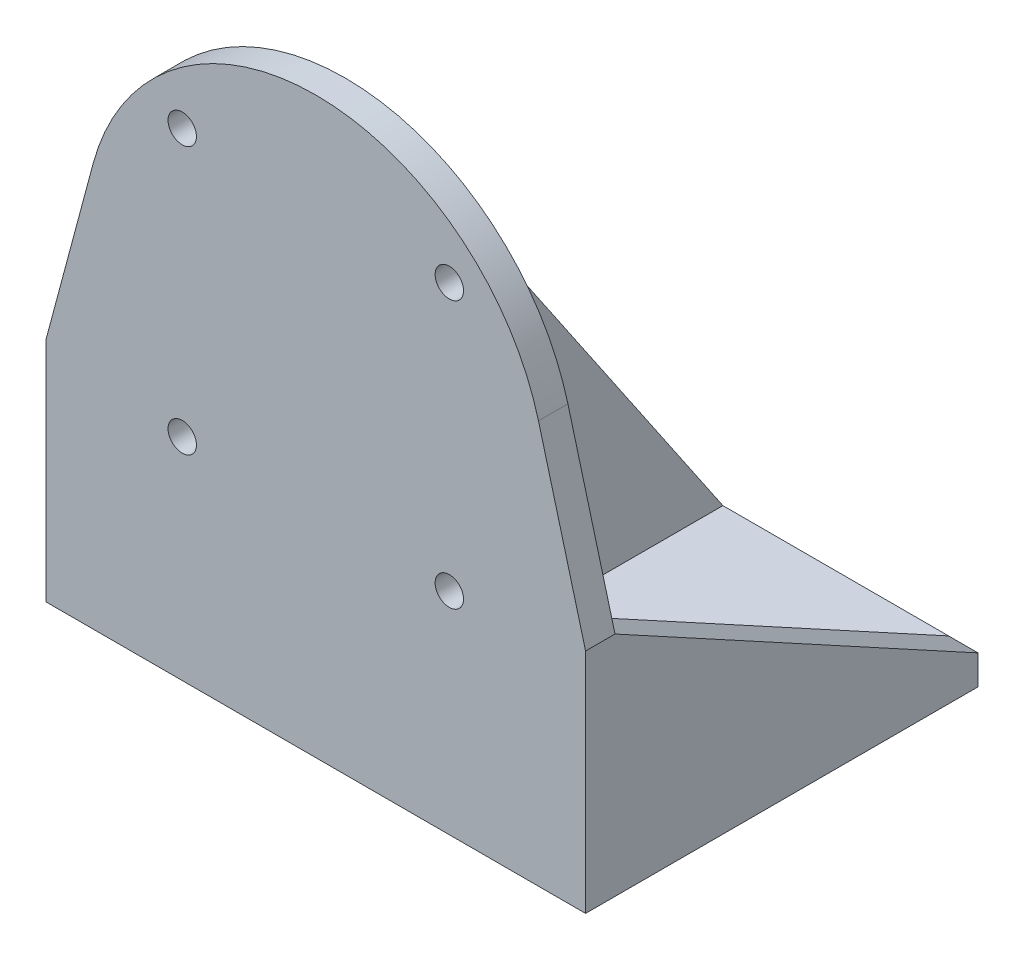
from build123d import *

# Parameters (mm, degrees)
SKETCH_1_R           = 1.447765
EXTRUDE_1_DEPTH      = 3
SKETCH_2_W           = 54.999996422
SKETCH_2_H           = 3
EXTRUDE_2_DEPTH      = 37
CUT_EXTRUDE_1_DEPTH  = 3
EXTRUDE_3_DEPTH      = 3
EXTRUDE_4_DEPTH      = 1.5
EXTRUDE_4_DEPTH_BACK = 1.5


with BuildPart() as part:
    # 草图1 → 凸台-拉伸1 (new body)
    with BuildSketch(Plane.XY):
        with BuildLine():
            Line((-13.887998211, -25.578349272), (-13.887998211, -48.743989272))
            Line((-13.887998211, -48.743989272), (41.111998211, -48.743989272))
            Line((41.111998211, -48.743989272), (41.111998211, -25.578349272))
            Line((41.111998211, -25.578349272), (36.311256918, -7.661738854))
            ThreePointArc((36.311256918, -7.661738854), (13.612, 9.756013586), (-9.087256918, -7.661738854))
            Line((-9.087256918, -7.661738854), (-13.887998211, -25.578349272))
        make_face()
        Circle(SKETCH_1_R, mode=Mode.SUBTRACT)
        with Locations((27.224, 0)):
            Circle(SKETCH_1_R, mode=Mode.SUBTRACT)
        with Locations((0, -27.224)):
            Circle(SKETCH_1_R, mode=Mode.SUBTRACT)
        with Locations((27.224, -27.224)):
            Circle(SKETCH_1_R, mode=Mode.SUBTRACT)
    extrude(amount=-EXTRUDE_1_DEPTH)

    # 草图2 → 凸台-拉伸2 (add)
    with BuildSketch(Plane(origin=(0, 0, -3), x_dir=(-1, 0, 0), z_dir=(0, 0, -1))):
        with Locations((-13.612, -47.243989272)):
            Rectangle(SKETCH_2_W, SKETCH_2_H)
    extrude(amount=EXTRUDE_2_DEPTH)

    # 草图3 → 切除-拉伸1 (cut)
    with BuildSketch(Plane(origin=(0, -45.743989272, 0), x_dir=(1, 0, 0), z_dir=(0, 1, 0))):
        with BuildLine():
            Line((32.311998211, 13), (32.311998211, 30))
            ThreePointArc((32.311998211, 30), (30.711998211, 31.6), (29.111998211, 30))
            Line((29.111998211, 30), (29.111998211, 13))
            ThreePointArc((29.111998211, 13), (30.711998211, 12.571016578), (32.311998211, 13))
        make_face()
        with BuildLine():
            Line((-1.887998211, 30), (-1.887998211, 13))
            ThreePointArc((-1.887998211, 13), (-3.487998211, 12.571016578), (-5.087998211, 13))
            Line((-5.087998211, 13), (-5.087998211, 30))
            ThreePointArc((-5.087998211, 30), (-3.487998211, 31.6), (-1.887998211, 30))
        make_face()
    extrude(amount=-CUT_EXTRUDE_1_DEPTH, mode=Mode.SUBTRACT)

    # 草图4 → 凸台-拉伸3 (add)
    with BuildSketch(Plane(origin=(41.111998211, 0, 0), x_dir=(0, 0, -1), z_dir=(1, 0, 0))):
        Polygon((40, -45.743989272), (3, -25.578345661), (3, -45.743989272), align=None)
    extrude_3 = extrude(amount=-EXTRUDE_3_DEPTH)

    # 草图13 → 凸台-拉伸4 (add, two sides: drawn at the far end of the back side and taken through both)
    with BuildSketch(Plane(origin=(13.612, 0, 0), x_dir=(0, 1, 0), z_dir=(-1, 0, 0)).offset(-EXTRUDE_4_DEPTH_BACK)):
        Polygon((-45.743989272, 40), (8.756018173, 3), (-45.743989272, 3), align=None)
    extrude(amount=EXTRUDE_4_DEPTH + EXTRUDE_4_DEPTH_BACK)

    # 镜向1: 凸台-拉伸3 across plane
    add(extrude_3.mirror(Plane.ZY.offset(-13.612)))


solid = part.part
